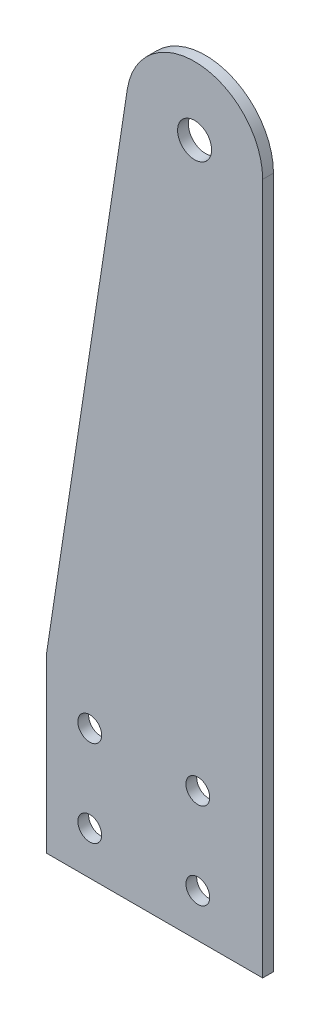
from build123d import *

# Parameters (mm, degrees)
SKETCH1_R           = 5
SKETCH1_R_2         = 3.5
BOSS_EXTRUDE1_DEPTH = 3.175


with BuildPart() as part:
    # Sketch1 → Boss-Extrude1 (new body)
    with BuildSketch(Plane.XY):
        with BuildLine():
            Line((-31.75, -25.4), (31.75, -25.4))
            Line((31.75, -25.4), (31.75, 177.8))
            ThreePointArc((31.75, 177.8), (13.263638058, 197.742640242), (-8.020889983, 180.818593926))
            Line((-8.020889983, 180.818593926), (-31.75, 25.4))
            Line((-31.75, 25.4), (-31.75, -25.4))
        make_face()
        with Locations((11.75, 177.8)):
            Circle(SKETCH1_R, mode=Mode.SUBTRACT)
        with Locations((-19.05, 12.7)):
            Circle(SKETCH1_R_2, mode=Mode.SUBTRACT)
        with Locations((12.7, 12.7)):
            Circle(SKETCH1_R_2, mode=Mode.SUBTRACT)
        with Locations((12.7, -12.7)):
            Circle(SKETCH1_R_2, mode=Mode.SUBTRACT)
        with Locations((-19.05, -12.7)):
            Circle(SKETCH1_R_2, mode=Mode.SUBTRACT)
    extrude(amount=BOSS_EXTRUDE1_DEPTH)


solid = part.part
